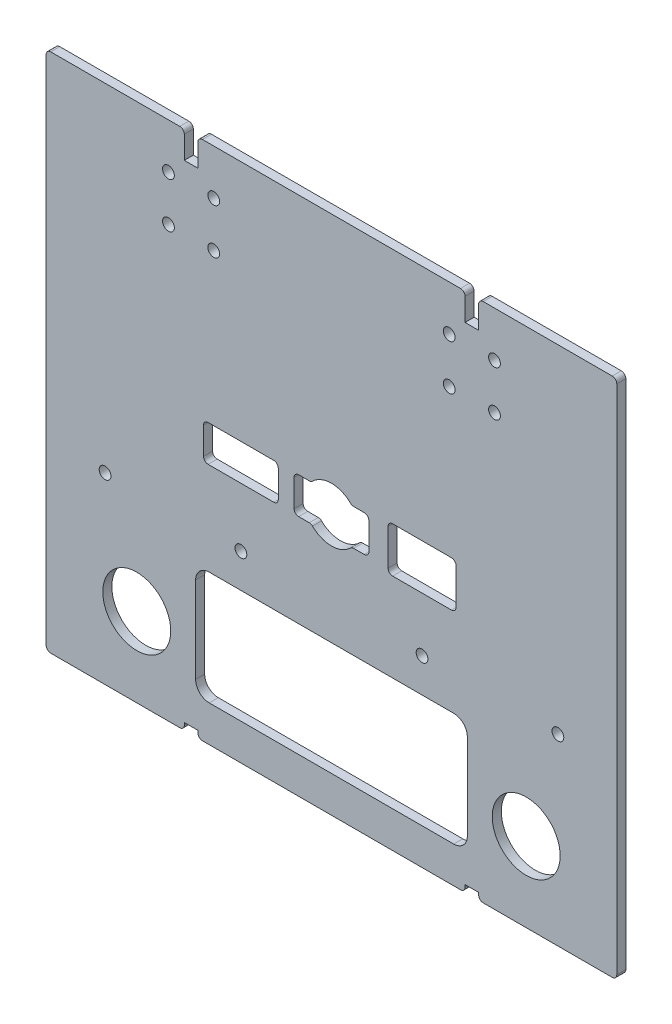
from build123d import *

# Parameters (mm, degrees)
SKETCH1_W           = 126
SKETCH1_H           = 115
BOSS_EXTRUDE1_DEPTH = 2
SKETCH2_W           = 60
SKETCH2_H           = 25
SKETCH2_R           = 7.5
CUT_EXTRUDE1_DEPTH  = 2
FILLET1_R           = 3
SKETCH3_R           = 1.3
CUT_EXTRUDE2_DEPTH  = 4
SKETCH4_W           = 3
SKETCH4_H           = 6
SKETCH4_H_2         = 1.5
CUT_EXTRUDE3_DEPTH  = 10
FILLET2_R           = 1
SKETCH6_W           = 15
SKETCH6_H           = 10
SKETCH6_W_2         = 16.5
SKETCH6_H_2         = 8
CUT_EXTRUDE5_DEPTH  = 10
FILLET3_R           = 1
SKETCH7_R           = 1.3
CUT_EXTRUDE6_DEPTH  = 2.5


with BuildPart() as part:
    # Sketch1 → Boss-Extrude1 (new body)
    with BuildSketch(Plane.XY):
        Rectangle(SKETCH1_W, SKETCH1_H)
    extrude(amount=BOSS_EXTRUDE1_DEPTH)

    # Sketch2 → Cut-Extrude1 (cut)
    with BuildSketch(Plane.XY.offset(2)):
        with Locations((0, -37)):
            Rectangle(SKETCH2_W, SKETCH2_H)
        with Locations((-43, -40)):
            Circle(SKETCH2_R)
        with Locations((43, -40)):
            Circle(SKETCH2_R)
    extrude(amount=-CUT_EXTRUDE1_DEPTH, mode=Mode.SUBTRACT)

    # Fillet1
    fillet1_edges = [part.edges().sort_by_distance(p)[0] for p in [
        (30, -49.5, 1),
        (-30, -49.5, 1),
        (30, -24.5, 1),
        (-30, -24.5, 1),
    ]]
    fillet(fillet1_edges, radius=FILLET1_R)

    # Sketch3 → Cut-Extrude2 (cut)
    with BuildSketch(Plane.XY.offset(2)):
        with Locations((-26, 47.5)):
            Circle(SKETCH3_R)
        with Locations((-36, 47.5)):
            Circle(SKETCH3_R)
        with Locations((36, 47.5)):
            Circle(SKETCH3_R)
        with Locations((26, 47.5)):
            Circle(SKETCH3_R)
        with Locations((-26, 37.5)):
            Circle(SKETCH3_R)
        with Locations((-36, 37.5)):
            Circle(SKETCH3_R)
        with Locations((36, 37.5)):
            Circle(SKETCH3_R)
        with Locations((26, 37.5)):
            Circle(SKETCH3_R)
    extrude(amount=-CUT_EXTRUDE2_DEPTH, mode=Mode.SUBTRACT)

    # Sketch4 → Cut-Extrude3 (cut)
    with BuildSketch(Plane(origin=(0, 0, 0), x_dir=(-1, 0, 0), z_dir=(0, 0, -1))):
        with Locations((-31, 54.5)):
            Rectangle(SKETCH4_W, SKETCH4_H)
        with Locations((31, 54.5)):
            Rectangle(SKETCH4_W, SKETCH4_H)
        with Locations((31, -56.75)):
            Rectangle(SKETCH4_W, SKETCH4_H_2)
        with Locations((-31, -56.75)):
            Rectangle(SKETCH4_W, SKETCH4_H_2)
    extrude(amount=-CUT_EXTRUDE3_DEPTH, mode=Mode.SUBTRACT)

    # Fillet2
    fillet2_edges = [part.edges().sort_by_distance(p)[0] for p in [
        (-32.5, 57.5, 1),
        (-29.5, 57.5, 1),
        (29.5, 57.5, 1),
        (32.5, 57.5, 1),
        (-63, 57.5, 1),
        (63, 57.5, 1),
        (-63, -57.5, 1),
        (63, -57.5, 1),
        (32.5, -57.5, 1),
        (29.5, -57.5, 1),
        (-29.5, -57.5, 1),
        (-32.5, -57.5, 1),
    ]]
    fillet(fillet2_edges, radius=FILLET2_R)

    # Sketch6 → Cut-Extrude5 (cut)
    with BuildSketch(Plane.XY.offset(2)):
        with BuildLine():
            Line((-4.472135955, 4), (-8.25, 4))
            Line((-8.25, 4), (-8.25, -4))
            Line((-8.25, -4), (-4.472135955, -4))
            ThreePointArc((-4.472135955, -4), (0, -6), (4.472135955, -4))
            Line((4.472135955, -4), (8.25, -4))
            Line((8.25, -4), (8.25, 4))
            Line((8.25, 4), (4.472135955, 4))
            ThreePointArc((4.472135955, 4), (0, 6), (-4.472135955, 4))
        make_face()
        with Locations((20, 0)):
            Rectangle(SKETCH6_W, SKETCH6_H)
        with Locations((-20, 0)):
            Rectangle(SKETCH6_W_2, SKETCH6_H_2)
    extrude(amount=-CUT_EXTRUDE5_DEPTH, mode=Mode.SUBTRACT)

    # Fillet3
    fillet3_edges = [part.edges().sort_by_distance(p)[0] for p in [
        (12.5, 5, 1),
        (27.5, 5, 1),
        (27.5, -5, 1),
        (12.5, -5, 1),
        (-8.25, -4, 1),
        (-4.472135955, -4, 1),
        (4.472135955, -4, 1),
        (8.25, -4, 1),
        (8.25, 4, 1),
        (4.472135955, 4, 1),
        (-4.472135955, 4, 1),
        (-8.25, 4, 1),
        (-11.75, 4, 1),
        (-11.75, -4, 1),
        (-28.25, -4, 1),
        (-28.25, 4, 1),
    ]]
    fillet(fillet3_edges, radius=FILLET3_R)

    # Sketch7 → Cut-Extrude6 (cut)
    with BuildSketch(Plane(origin=(0, 0, 0), x_dir=(-1, 0, 0), z_dir=(0, 0, -1))):
        with Locations((-50, -17)):
            Circle(SKETCH7_R)
        with Locations((-20, -17)):
            Circle(SKETCH7_R)
        with Locations((20, -17)):
            Circle(SKETCH7_R)
        with Locations((50, -17)):
            Circle(SKETCH7_R)
    extrude(amount=-CUT_EXTRUDE6_DEPTH, mode=Mode.SUBTRACT)


solid = part.part
